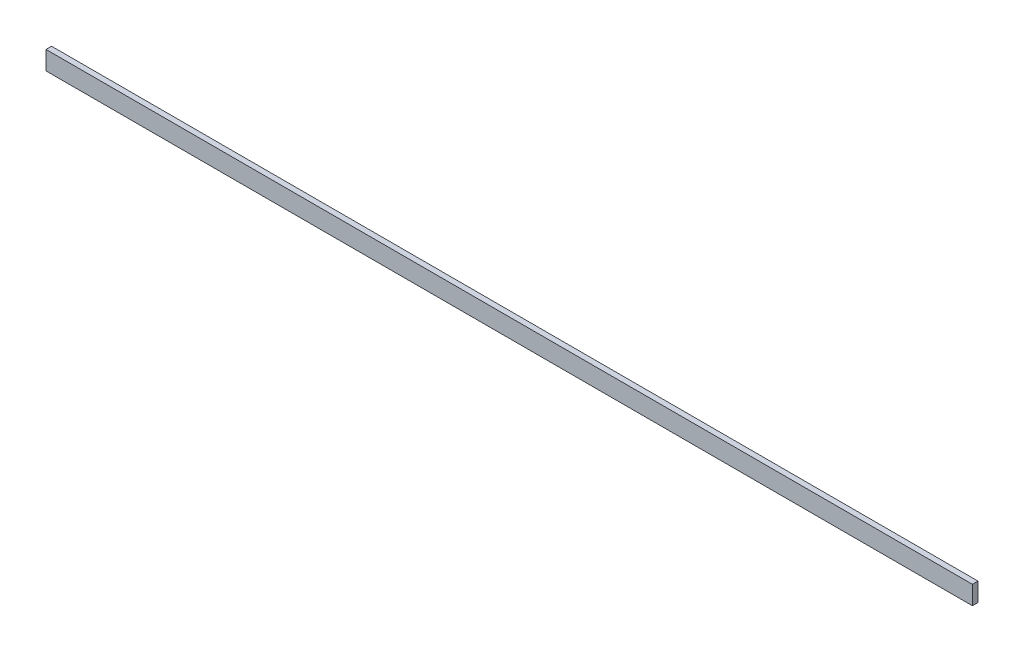
from build123d import *

# Parameters (mm, degrees)
IZIM1_W            = 2490
IZIM1_H            = 50
TABAN_FLAN_1_DEPTH = 15


# Sheet-metal steps are written as plain solids
with BuildPart() as part:
    # Çizim1 → Taban-Flanş1 (new body)
    with BuildSketch(Plane.XY):
        with Locations((1245, -25)):
            Rectangle(IZIM1_W, IZIM1_H)
    extrude(amount=-TABAN_FLAN_1_DEPTH)


solid = part.part
